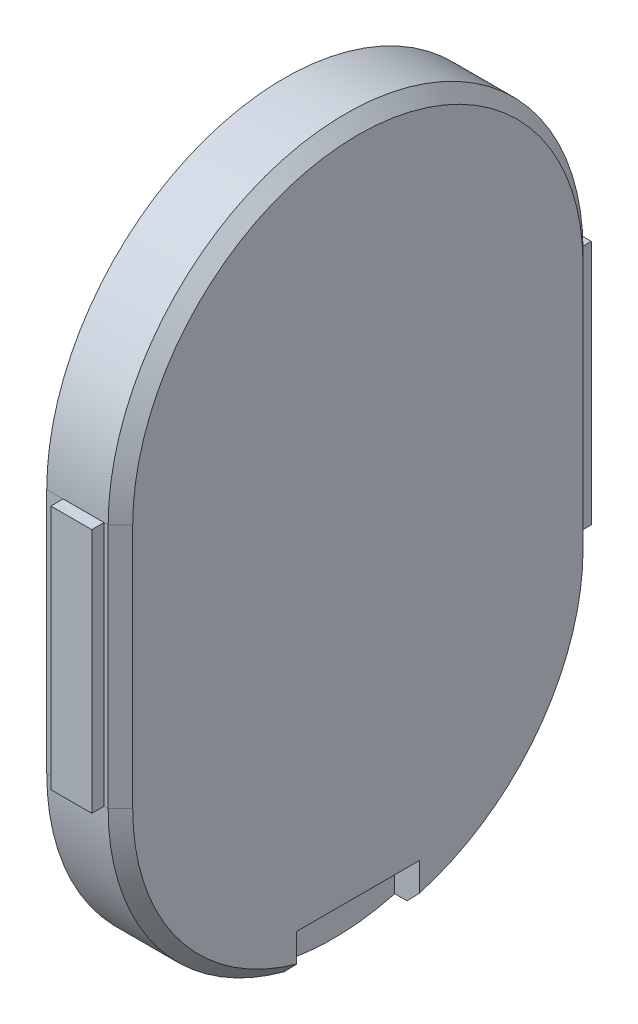
from build123d import *

# Parameters (mm, degrees)
BOSS_EXTRUDE1_START = 36.2
BOSS_EXTRUDE1_DEPTH = 1.8
CHAMFER1_SIZE       = 0.3
BOSS_EXTRUDE2_START = 82.2
SKETCH2_W           = 1
SKETCH2_H           = 6
BOSS_EXTRUDE2_DEPTH = 0.31
BOSS_EXTRUDE3_START = 94.09
SKETCH3_W           = 1
SKETCH3_H           = 6
BOSS_EXTRUDE3_DEPTH = 0.31
BOSS_EXTRUDE4_START = 86.8
SKETCH4_W           = 0.7
SKETCH4_H           = 1.3
BOSS_EXTRUDE4_DEPTH = 3


with BuildPart() as part:
    # Sketch1 → Boss-Extrude1 (new body)
    with BuildSketch(Plane(origin=(0, 0, 0), x_dir=(0, 0, -1), z_dir=(1, 0, 0)).offset(BOSS_EXTRUDE1_START)):
        with BuildLine():
            Line((-94.1, 53), (-94.1, 59))
            ThreePointArc((-94.1, 59), (-92.401219331, 63.101219331), (-88.3, 64.8))
            ThreePointArc((-88.3, 64.8), (-84.198780669, 63.101219331), (-82.5, 59))
            Line((-82.5, 59), (-82.5, 53))
            ThreePointArc((-82.5, 53), (-84.198780669, 48.898780669), (-88.3, 47.2))
            ThreePointArc((-88.3, 47.2), (-92.401219331, 48.898780669), (-94.1, 53))
        make_face()
    extrude(amount=BOSS_EXTRUDE1_DEPTH)

    # Chamfer1
    chamfer1_edges = [part.edges().sort_by_distance(p)[0] for p in [
        (38, 47.2, 88.3),
        (38, 56, 82.5),
        (38, 56, 94.1),
        (38, 64.8, 88.3),
    ]]
    chamfer(chamfer1_edges, length=CHAMFER1_SIZE)

    # Sketch2 → Boss-Extrude2 (add)
    with BuildSketch(Plane.XY.offset(BOSS_EXTRUDE2_START)):
        with Locations((37.1, 56)):
            Rectangle(SKETCH2_W, SKETCH2_H)
    extrude(amount=BOSS_EXTRUDE2_DEPTH)

    # Sketch3 → Boss-Extrude3 (add)
    with BuildSketch(Plane.XY.offset(BOSS_EXTRUDE3_START)):
        with Locations((37.1, 56)):
            Rectangle(SKETCH3_W, SKETCH3_H)
    extrude(amount=BOSS_EXTRUDE3_DEPTH)


with BuildPart() as body_2:
    # Sketch4 → Boss-Extrude4 (new body)
    with BuildSketch(Plane.XY.offset(BOSS_EXTRUDE4_START)):
        with Locations((37.75, 47.75)):
            Rectangle(SKETCH4_W, SKETCH4_H)
    extrude(amount=BOSS_EXTRUDE4_DEPTH)


with BuildPart() as part_1:
    add(part.part)

    # Combine1: cut body 2
    add(body_2.part, mode=Mode.SUBTRACT)


solid = part_1.part
